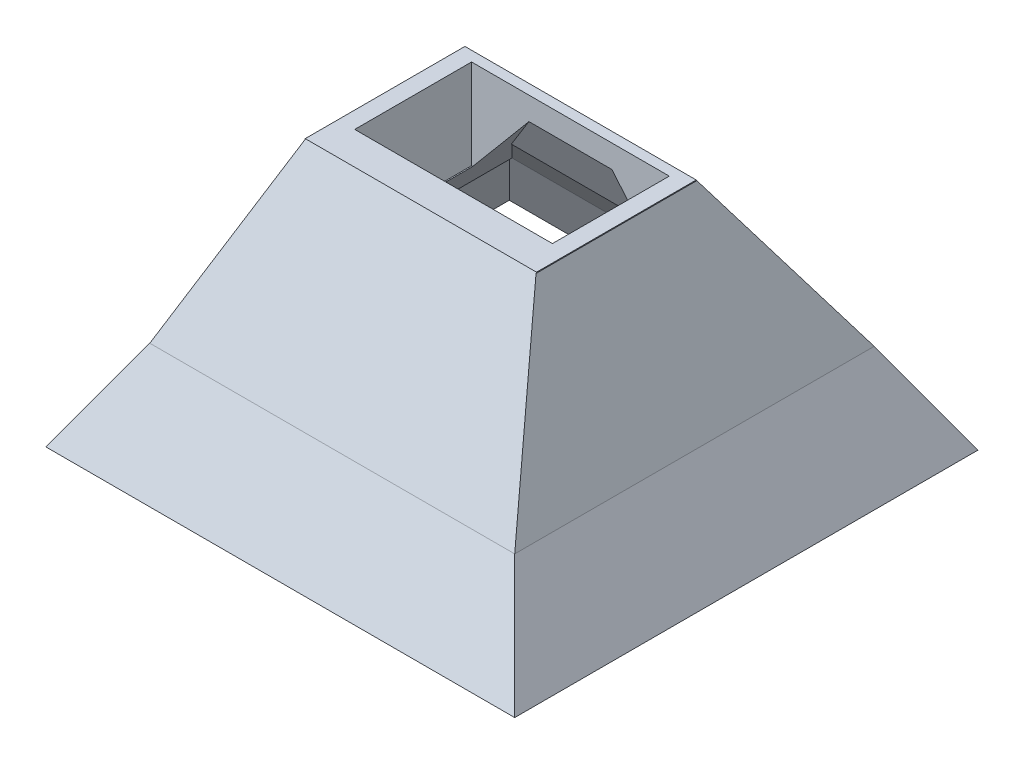
from build123d import *
from OCP.BRepFilletAPI import BRepFilletAPI_MakeChamfer

# Parameters (mm, degrees)
SKETCH1_W               = 40
SKETCH1_H               = 40
BOSS_EXTRUDE1_DEPTH     = 8.5
BOSS_EXTRUDE1_TAPER     = 40
SKETCH2_W               = 36
SKETCH2_H               = 36
CUT_EXTRUDE1_DEPTH      = 15
CUT_EXTRUDE1_DRAFT      = -40
SKETCH4_W               = 25.73530627
SKETCH4_H               = 25.73530627
BOSS_EXTRUDE3_DEPTH     = 10
SKETCH5_W               = 22
SKETCH5_H               = 13
CUT_EXTRUDE2_DEPTH      = 31.000000133
CHAMFER2_SIZE           = 12
CHAMFER2_SIZE_2         = 9.89892863
CUT_EXTRUDE3_DEPTH      = 35.154586706
CUT_EXTRUDE3_DEPTH_BACK = 35.154586706
CHAMFER3_SIZE           = 4.3
CHAMFER3_SIZE2          = 7.447818473
CUT_EXTRUDE4_DEPTH      = 35.154586706
CUT_EXTRUDE4_DEPTH_BACK = 35.154586706
SKETCH9_W               = 40.602605658
SKETCH9_H               = 40
BOSS_EXTRUDE4_DEPTH     = 10
BOSS_EXTRUDE4_DRAFT     = -30
SKETCH10_W              = 36.602605658
SKETCH10_H              = 36
CUT_EXTRUDE5_DEPTH      = 10
CUT_EXTRUDE5_DRAFT      = 30


with BuildPart() as part:
    # Sketch1 → Boss-Extrude1 (new body)
    with BuildSketch(Plane(origin=(0, 0, 0), x_dir=(1, 0, 0), z_dir=(0, 1, 0))):
        Rectangle(SKETCH1_W, SKETCH1_H)
    extrude(amount=BOSS_EXTRUDE1_DEPTH, taper=BOSS_EXTRUDE1_TAPER)


with BuildPart() as cut_extrude1_tool:
    # Sketch2 → Cut-Extrude1 (with draft: the straight prism first)
    with BuildSketch(Plane.XZ):
        Rectangle(SKETCH2_W, SKETCH2_H)
    extrude(amount=-CUT_EXTRUDE1_DEPTH)
    # Cut-Extrude1: the draft: its side faces are tilted about the plane it starts from
    cut_extrude1_sides = [cut_extrude1_tool.faces().sort_by_distance(p)[0] for p in [
        (0, 7.5, -18),
        (18, 7.5, 0),
        (0, 7.5, 18),
        (-18, 7.5, 0),
    ]]
    draft(cut_extrude1_sides, Plane.XZ, CUT_EXTRUDE1_DRAFT)


with BuildPart() as part_1:
    add(part.part)

    # Cut-Extrude1: cut by cut_extrude1_tool
    add(cut_extrude1_tool.part, mode=Mode.SUBTRACT)

    # Sketch4 → Boss-Extrude3 (add)
    with BuildSketch(Plane(origin=(0, 8.5, 0), x_dir=(1, 0, 0), z_dir=(0, 1, 0))):
        Rectangle(SKETCH4_W, SKETCH4_H)
    extrude(amount=BOSS_EXTRUDE3_DEPTH)

    # Sketch5 → Cut-Extrude2 (cut, through all)
    with BuildSketch(Plane.XZ.offset(-8.5)):
        Rectangle(SKETCH5_W, SKETCH5_H)
    extrude(amount=-CUT_EXTRUDE2_DEPTH, mode=Mode.SUBTRACT)

    # Chamfer2
    # the kernel refuses this chamfer: 12, 9.89892863 mm, written as the material it adds along each edge
    with BuildSketch(Plane(origin=(12.867653135, 8.5, 44.011128682), x_dir=(0.6427876096865404, -0.7660444431189772, 0), z_dir=(0, 0, -1))) as chamfer2_piece_1_section:
        Polygon((CHAMFER2_SIZE, 0), (-CHAMFER2_SIZE_2 * 0.766044443108, -CHAMFER2_SIZE_2 * 0.642787609677), (0, 0), align=None)
    chamfer2_piece_1 = extrude(amount=88.022257365, mode=Mode.PRIVATE)
    chamfer2_piece_1 = split(chamfer2_piece_1, bisect_by=Plane(origin=(12.867653135, 0, 44.011128682), z_dir=(0, 1, 0)), keep=Keep.TOP, mode=Mode.PRIVATE)
    chamfer2_piece_1 = split(chamfer2_piece_1, bisect_by=Plane(origin=(12.867653135, -0.927920344, 20.676206983), z_dir=(0, -0.37460659341591307, -0.927183854566787)), keep=Keep.TOP, mode=Mode.PRIVATE)
    chamfer2_piece_1 = split(chamfer2_piece_1, bisect_by=Plane(origin=(12.867653135, 29.644778588, -8.32403482), z_dir=(0, -0.3746065934159128, 0.9271838545667871)), keep=Keep.TOP, mode=Mode.PRIVATE)
    add(chamfer2_piece_1)
    with BuildSketch(Plane(origin=(-12.867653135, 8.5, -44.011128682), x_dir=(-0.6427876096865406, -0.766044443118977, 0), z_dir=(0, 0, 1))) as chamfer2_piece_2_section:
        Polygon((CHAMFER2_SIZE, 0), (-CHAMFER2_SIZE_2 * 0.766044443108, -CHAMFER2_SIZE_2 * 0.642787609677), (0, 0), align=None)
    chamfer2_piece_2 = extrude(amount=88.022257365, mode=Mode.PRIVATE)
    chamfer2_piece_2 = split(chamfer2_piece_2, bisect_by=Plane(origin=(-12.867653135, 0, -44.011128682), z_dir=(0, 1, 0)), keep=Keep.TOP, mode=Mode.PRIVATE)
    chamfer2_piece_2 = split(chamfer2_piece_2, bisect_by=Plane(origin=(-12.867653135, -0.927920344, -20.676206983), z_dir=(0, -0.3746065934159128, 0.9271838545667871)), keep=Keep.TOP, mode=Mode.PRIVATE)
    chamfer2_piece_2 = split(chamfer2_piece_2, bisect_by=Plane(origin=(-12.867653135, 29.644778588, 8.32403482), z_dir=(0, -0.37460659341591307, -0.927183854566787)), keep=Keep.TOP, mode=Mode.PRIVATE)
    add(chamfer2_piece_2)
    with BuildSketch(Plane(origin=(-44.011128682, 8.5, 12.867653135), x_dir=(0, -0.766044443118977, 0.6427876096865405), z_dir=(1, 0, 0))) as chamfer2_piece_3_section:
        Polygon((CHAMFER2_SIZE, 0), (-CHAMFER2_SIZE_2 * 0.766044443108, -CHAMFER2_SIZE_2 * 0.642787609677), (0, 0), align=None)
    chamfer2_piece_3 = extrude(amount=88.022257365, mode=Mode.PRIVATE)
    chamfer2_piece_3 = split(chamfer2_piece_3, bisect_by=Plane(origin=(-44.011128682, 0, 12.867653135), z_dir=(0, 1, 0)), keep=Keep.TOP, mode=Mode.PRIVATE)
    chamfer2_piece_3 = split(chamfer2_piece_3, bisect_by=Plane(origin=(-20.676206983, -0.927920344, 12.867653135), z_dir=(0.927183854566787, -0.37460659341591307, 0)), keep=Keep.TOP, mode=Mode.PRIVATE)
    chamfer2_piece_3 = split(chamfer2_piece_3, bisect_by=Plane(origin=(8.32403482, 29.644778588, 12.867653135), z_dir=(-0.9271838545667872, -0.37460659341591274, 0)), keep=Keep.TOP, mode=Mode.PRIVATE)
    add(chamfer2_piece_3)
    with BuildSketch(Plane(origin=(44.011128682, 8.5, -12.867653135), x_dir=(0, -0.766044443118977, -0.6427876096865405), z_dir=(-1, 0, 0))) as chamfer2_piece_4_section:
        Polygon((CHAMFER2_SIZE, 0), (-CHAMFER2_SIZE_2 * 0.766044443108, -CHAMFER2_SIZE_2 * 0.642787609677), (0, 0), align=None)
    chamfer2_piece_4 = extrude(amount=88.022257365, mode=Mode.PRIVATE)
    chamfer2_piece_4 = split(chamfer2_piece_4, bisect_by=Plane(origin=(44.011128682, 0, -12.867653135), z_dir=(0, 1, 0)), keep=Keep.TOP, mode=Mode.PRIVATE)
    chamfer2_piece_4 = split(chamfer2_piece_4, bisect_by=Plane(origin=(-8.32403482, 29.644778588, -12.867653135), z_dir=(0.927183854566787, -0.37460659341591307, 0)), keep=Keep.TOP, mode=Mode.PRIVATE)
    chamfer2_piece_4 = split(chamfer2_piece_4, bisect_by=Plane(origin=(20.676206983, -0.927920344, -12.867653135), z_dir=(-0.9271838545667872, -0.37460659341591274, 0)), keep=Keep.TOP, mode=Mode.PRIVATE)
    add(chamfer2_piece_4)

    # Sketch7 → Cut-Extrude3 (cut, two sides: drawn at the far end of the back side and taken through both)
    with BuildSketch(Plane(origin=(0, 0, 0), x_dir=(0, 0, -1), z_dir=(1, 0, 0)).offset(-CUT_EXTRUDE3_DEPTH_BACK)):
        Polygon((-20, 0), (-24.78585356, 0), (-24.78585356, 18.532984169), (-10.14, 18.5), align=None)
    extrude(amount=CUT_EXTRUDE3_DEPTH + CUT_EXTRUDE3_DEPTH_BACK, mode=Mode.SUBTRACT)

    # Chamfer3: one chamfer whose edges measure the first distance from different faces: ONE call of the kernel's chamfer builder (chamfer() names one face for all edges)
    chamfer3_edges_1 = [part_1.edges().sort_by_distance(p)[0] for p in [
        (0, 8.5, 6.5),
    ]]
    chamfer3_side_1 = [part_1.faces().sort_by_distance(p)[0] for p in [
        (0, 8.5, 8.683826567),
    ]]
    chamfer3_edges_2 = [part_1.edges().sort_by_distance(p)[0] for p in [
        (0, 8.5, -6.5),
    ]]
    chamfer3_side_2 = [part_1.faces().sort_by_distance(p)[0] for p in [
        (0, 8.5, -8.683826567),
    ]]
    chamfer3 = BRepFilletAPI_MakeChamfer(part_1.part.solid().wrapped)
    for e in chamfer3_edges_1:
        chamfer3.Add(CHAMFER3_SIZE, CHAMFER3_SIZE2, e.wrapped, chamfer3_side_1[0].wrapped)  # the first distance lies on this face
    for e in chamfer3_edges_2:
        chamfer3.Add(CHAMFER3_SIZE, CHAMFER3_SIZE2, e.wrapped, chamfer3_side_2[0].wrapped)  # the first distance lies on this face
    add(Compound.cast(chamfer3.Shape()), mode=Mode.REPLACE)

    # Sketch8 → Cut-Extrude4 (cut, two sides: drawn at the far end of the back side and taken through both)
    with BuildSketch(Plane(origin=(0, 0, 0), x_dir=(0, 0, -1), z_dir=(1, 0, 0)).offset(-CUT_EXTRUDE4_DEPTH_BACK)):
        Polygon((7.63, 18.5), (12.867653135, 18.5), (21.160182577, 0), (20, 0), align=None)
    extrude(amount=CUT_EXTRUDE4_DEPTH + CUT_EXTRUDE4_DEPTH_BACK, mode=Mode.SUBTRACT)


with BuildPart() as boss_extrude4_tool:
    # Sketch9 → Boss-Extrude4 (with draft: the straight prism first)
    with BuildSketch(Plane.XZ):
        Rectangle(SKETCH9_W, SKETCH9_H)
    extrude(amount=BOSS_EXTRUDE4_DEPTH)
    # Boss-Extrude4: the draft: its side faces are tilted about the plane it starts from
    boss_extrude4_sides = [boss_extrude4_tool.faces().sort_by_distance(p)[0] for p in [
        (0, -5, -20),
        (20.301302829, -5, 0),
        (0, -5, 20),
        (-20.301302829, -5, 0),
    ]]
    draft(boss_extrude4_sides, Plane.XZ, BOSS_EXTRUDE4_DRAFT)


with BuildPart() as part_2:
    add(part_1.part)

    # Boss-Extrude4: add boss_extrude4_tool
    add(boss_extrude4_tool.part)


with BuildPart() as cut_extrude5_tool:
    # Sketch10 → Cut-Extrude5 (with draft: the straight prism first)
    with BuildSketch(Plane(origin=(0, 0, 0), x_dir=(1, 0, 0), z_dir=(0, 1, 0))):
        Rectangle(SKETCH10_W, SKETCH10_H)
    extrude(amount=-CUT_EXTRUDE5_DEPTH)
    # Cut-Extrude5: the draft: its side faces are tilted about the plane it starts from
    cut_extrude5_sides = [cut_extrude5_tool.faces().sort_by_distance(p)[0] for p in [
        (0, -5, 18),
        (18.301302829, -5, 0),
        (0, -5, -18),
        (-18.301302829, -5, 0),
    ]]
    draft(cut_extrude5_sides, Plane(origin=(0, 0, 0), x_dir=(1, 0, 0), z_dir=(0, 1, 0)), CUT_EXTRUDE5_DRAFT)


with BuildPart() as part_3:
    add(part_2.part)

    # Cut-Extrude5: cut by cut_extrude5_tool
    add(cut_extrude5_tool.part, mode=Mode.SUBTRACT)


solid = part_3.part
